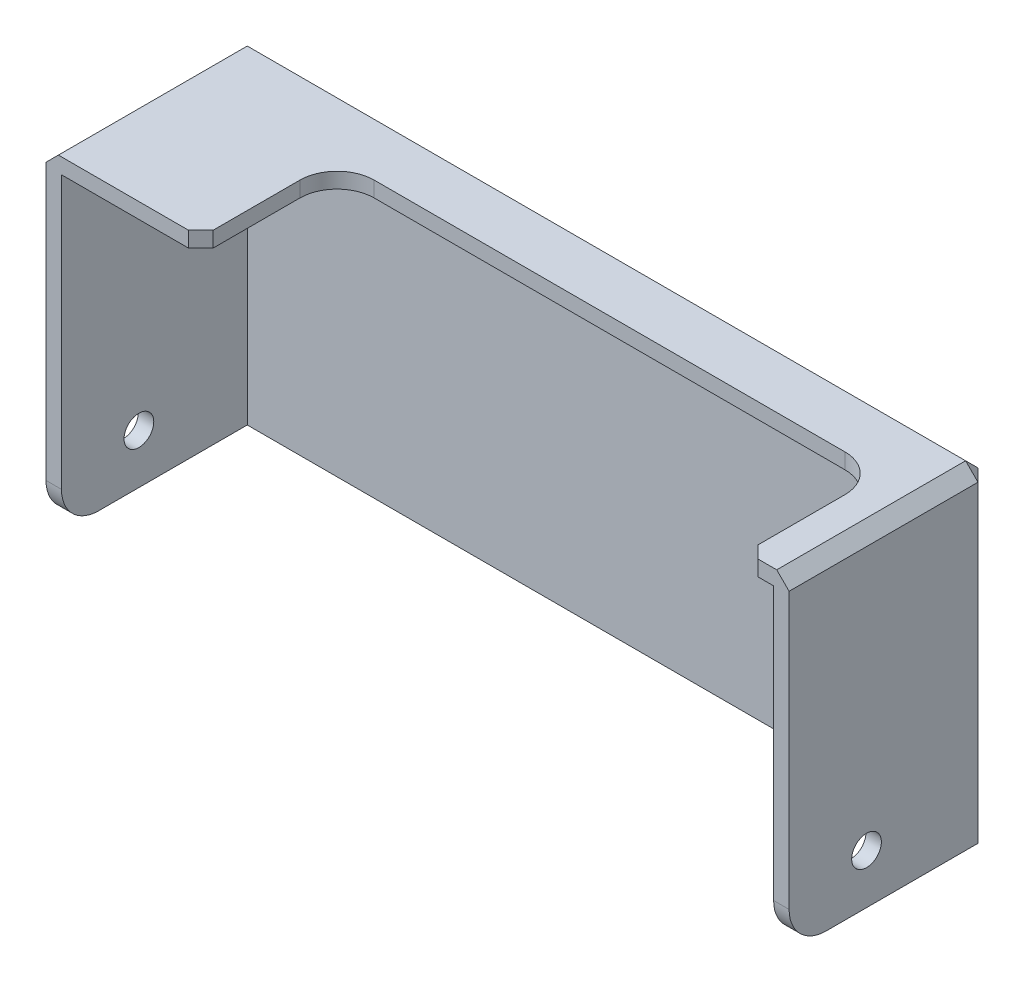
from build123d import *

# Parameters (mm, degrees)
SKETCH1_W            = 115
SKETCH1_H            = 50
BOSS_EXTRUDE1_DEPTH  = 30
SKETCH2_W            = 88
SKETCH2_H            = 22
CUT_EXTRUDE1_DEPTH   = 82.891696771
SHELL1_T             = 2.5
M4_CLEARANCE_HOLE1_D = 4.8
CHAMFER1_SIZE        = 2
FILLET1_R            = 6
FILLET2_R            = 6


with BuildPart() as part:
    # Sketch1 → Boss-Extrude1 (new body)
    with BuildSketch(Plane.XY):
        Rectangle(SKETCH1_W, SKETCH1_H)
    extrude(amount=BOSS_EXTRUDE1_DEPTH)

    # Sketch2 → Cut-Extrude1 (cut, through all)
    with BuildSketch(Plane(origin=(0, 25, 0), x_dir=(1, 0, 0), z_dir=(0, 1, 0))):
        with Locations((9, -19)):
            Rectangle(SKETCH2_W, SKETCH2_H)
    extrude(amount=-CUT_EXTRUDE1_DEPTH, mode=Mode.SUBTRACT)

    # Shell1
    shell1_openings = [part.faces().sort_by_distance(p)[0] for p in [
        (-35, 0, 19),
        (9, 0, 8),
        (53, 0, 19),
        (55.25, 0, 30),
        (0, -25, 1.188486432),
        (-46.25, 0, 30),
    ]]
    offset(amount=SHELL1_T, openings=shell1_openings, kind=Kind.INTERSECTION)

    # M4 Clearance Hole1 (through all)
    with Locations(Plane.ZY.offset(60)):
        with Locations((17.5, -17)):
            Hole(M4_CLEARANCE_HOLE1_D / 2)

    # Chamfer1
    chamfer1_edges = [part.edges().sort_by_distance(p)[0] for p in [
        (0, 27.5, -2.5),
        (60, 27.5, 13.75),
        (60, 1.25, -2.5),
        (0, -25, -2.5),
        (-60, 1.25, -2.5),
        (-60, 27.5, 13.75),
        (53, 26.25, 30),
        (-35, 26.25, 30),
    ]]
    chamfer(chamfer1_edges, length=CHAMFER1_SIZE)

    # Fillet1
    fillet1_edges = [part.edges().sort_by_distance(p)[0] for p in [
        (-35, 26.25, 8),
        (53, 26.25, 8),
    ]]
    fillet(fillet1_edges, radius=FILLET1_R)

    # Fillet2
    fillet2_edges = [part.edges().sort_by_distance(p)[0] for p in [
        (58.75, -25, 30),
        (-58.75, -25, 30),
    ]]
    fillet(fillet2_edges, radius=FILLET2_R)


solid = part.part
